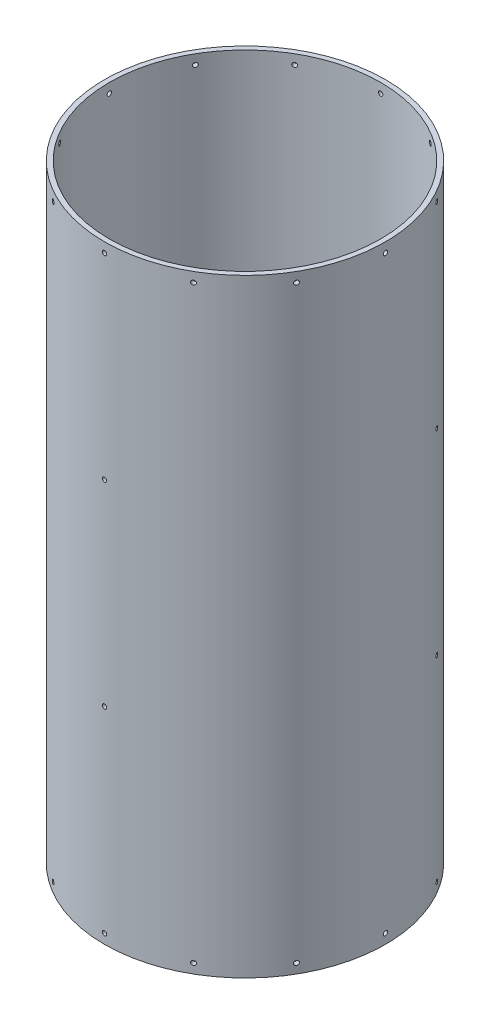
from build123d import *

# Parameters (mm, degrees)
SKETCH1_R                = 92.075
SKETCH1_R_2              = 88.9
BOSS_EXTRUDE1_DEPTH      = 199.39
SKETCH3_R                = 1.4351
CUT_EXTRUDE1_DEPTH       = 19.304
CIRPATTERN1_COUNT        = 12
MIRROR1_COPY_1_SKETCH_R  = 1.4351
MIRROR1_COPY_1_DEPTH     = 19.304
MIRROR1_COPY_2_SKETCH_R  = 1.4351
MIRROR1_COPY_2_DEPTH     = 19.304
MIRROR1_COPY_3_SKETCH_R  = 1.4351
MIRROR1_COPY_3_DEPTH     = 19.304
MIRROR1_COPY_4_SKETCH_R  = 1.4351
MIRROR1_COPY_4_DEPTH     = 19.304
MIRROR1_COPY_5_SKETCH_R  = 1.4351
MIRROR1_COPY_5_DEPTH     = 19.304
MIRROR1_COPY_6_SKETCH_R  = 1.4351
MIRROR1_COPY_6_DEPTH     = 19.304
MIRROR1_COPY_7_SKETCH_R  = 1.4351
MIRROR1_COPY_7_DEPTH     = 19.304
MIRROR1_COPY_8_SKETCH_R  = 1.4351
MIRROR1_COPY_8_DEPTH     = 19.304
MIRROR1_COPY_9_SKETCH_R  = 1.4351
MIRROR1_COPY_9_DEPTH     = 19.304
MIRROR1_COPY_10_SKETCH_R = 1.4351
MIRROR1_COPY_10_DEPTH    = 19.304
MIRROR1_COPY_11_SKETCH_R = 1.4351
MIRROR1_COPY_11_DEPTH    = 19.304
SKETCH4_R                = 1.4351
CUT_EXTRUDE2_DEPTH       = 43.18
CIRPATTERN2_COUNT        = 3


with BuildPart() as part:
    # Sketch1 → Boss-Extrude1 (new, symmetric)
    with BuildSketch(Plane(origin=(0, 0, 0), x_dir=(1, 0, 0), z_dir=(0, 1, 0))):
        Circle(SKETCH1_R)
        Circle(SKETCH1_R_2, mode=Mode.SUBTRACT)
    extrude(amount=BOSS_EXTRUDE1_DEPTH, both=True)

    # Sketch3 → Cut-Extrude1 (cut)
    with BuildSketch(Plane.XY.offset(92.075)):
        with Locations((0, -193.04)):
            Circle(SKETCH3_R)
    cut_extrude1 = extrude(amount=-CUT_EXTRUDE1_DEPTH, mode=Mode.SUBTRACT)

    # CirPattern1: Cut-Extrude1 ×12 about axis
    cirpattern1_axis = Axis((0, 199.39, 0), (0, -1, 0))
    for i in range(1, CIRPATTERN1_COUNT):
        add(cut_extrude1.rotate(cirpattern1_axis, i * 360 / CIRPATTERN1_COUNT), mode=Mode.SUBTRACT)

    # Mirror1: Cut-Extrude1 across plane
    add(cut_extrude1.mirror(Plane.ZX), mode=Mode.SUBTRACT)

    # Mirror1 copy 1 sketch → Mirror1 copy 1 (cut)
    with BuildSketch(Plane(origin=(-46.0375, 0, 79.739289053), x_dir=(0.8660254037844387, 0, 0.49999999999999994), z_dir=(-0.49999999999999994, 0, 0.8660254037844387))):
        with Locations((0, 193.04)):
            Circle(MIRROR1_COPY_1_SKETCH_R)
    extrude(amount=-MIRROR1_COPY_1_DEPTH, mode=Mode.SUBTRACT)

    # Mirror1 copy 2 sketch → Mirror1 copy 2 (cut)
    with BuildSketch(Plane(origin=(-79.739289053, 0, 46.0375), x_dir=(0.5000000000000001, 0, 0.8660254037844386), z_dir=(-0.8660254037844386, 0, 0.5000000000000001))):
        with Locations((0, 193.04)):
            Circle(MIRROR1_COPY_2_SKETCH_R)
    extrude(amount=-MIRROR1_COPY_2_DEPTH, mode=Mode.SUBTRACT)

    # Mirror1 copy 3 sketch → Mirror1 copy 3 (cut)
    with BuildSketch(Plane.ZY.offset(92.075)):
        with Locations((0, 193.04)):
            Circle(MIRROR1_COPY_3_SKETCH_R)
    extrude(amount=-MIRROR1_COPY_3_DEPTH, mode=Mode.SUBTRACT)

    # Mirror1 copy 4 sketch → Mirror1 copy 4 (cut)
    with BuildSketch(Plane(origin=(-79.739289053, 0, -46.0375), x_dir=(-0.4999999999999998, 0, 0.8660254037844387), z_dir=(-0.8660254037844387, 0, -0.4999999999999998))):
        with Locations((0, 193.04)):
            Circle(MIRROR1_COPY_4_SKETCH_R)
    extrude(amount=-MIRROR1_COPY_4_DEPTH, mode=Mode.SUBTRACT)

    # Mirror1 copy 5 sketch → Mirror1 copy 5 (cut)
    with BuildSketch(Plane(origin=(-46.0375, 0, -79.739289053), x_dir=(-0.8660254037844387, 0, 0.49999999999999994), z_dir=(-0.49999999999999994, 0, -0.8660254037844387))):
        with Locations((0, 193.04)):
            Circle(MIRROR1_COPY_5_SKETCH_R)
    extrude(amount=-MIRROR1_COPY_5_DEPTH, mode=Mode.SUBTRACT)

    # Mirror1 copy 6 sketch → Mirror1 copy 6 (cut)
    with BuildSketch(Plane(origin=(0, 0, -92.075), x_dir=(-1, 0, 0), z_dir=(0, 0, -1))):
        with Locations((0, 193.04)):
            Circle(MIRROR1_COPY_6_SKETCH_R)
    extrude(amount=-MIRROR1_COPY_6_DEPTH, mode=Mode.SUBTRACT)

    # Mirror1 copy 7 sketch → Mirror1 copy 7 (cut)
    with BuildSketch(Plane(origin=(46.0375, 0, -79.739289053), x_dir=(-0.8660254037844386, 0, -0.5000000000000001), z_dir=(0.5000000000000001, 0, -0.8660254037844386))):
        with Locations((0, 193.04)):
            Circle(MIRROR1_COPY_7_SKETCH_R)
    extrude(amount=-MIRROR1_COPY_7_DEPTH, mode=Mode.SUBTRACT)

    # Mirror1 copy 8 sketch → Mirror1 copy 8 (cut)
    with BuildSketch(Plane(origin=(79.739289053, 0, -46.0375), x_dir=(-0.5000000000000004, 0, -0.8660254037844384), z_dir=(0.8660254037844384, 0, -0.5000000000000004))):
        with Locations((0, 193.04)):
            Circle(MIRROR1_COPY_8_SKETCH_R)
    extrude(amount=-MIRROR1_COPY_8_DEPTH, mode=Mode.SUBTRACT)

    # Mirror1 copy 9 sketch → Mirror1 copy 9 (cut)
    with BuildSketch(Plane(origin=(92.075, 0, 0), x_dir=(0, 0, -1), z_dir=(1, 0, 0))):
        with Locations((0, 193.04)):
            Circle(MIRROR1_COPY_9_SKETCH_R)
    extrude(amount=-MIRROR1_COPY_9_DEPTH, mode=Mode.SUBTRACT)

    # Mirror1 copy 10 sketch → Mirror1 copy 10 (cut)
    with BuildSketch(Plane(origin=(79.739289053, 0, 46.0375), x_dir=(0.5000000000000001, 0, -0.8660254037844386), z_dir=(0.8660254037844386, 0, 0.5000000000000001))):
        with Locations((0, 193.04)):
            Circle(MIRROR1_COPY_10_SKETCH_R)
    extrude(amount=-MIRROR1_COPY_10_DEPTH, mode=Mode.SUBTRACT)

    # Mirror1 copy 11 sketch → Mirror1 copy 11 (cut)
    with BuildSketch(Plane(origin=(46.0375, 0, 79.739289053), x_dir=(0.8660254037844384, 0, -0.5000000000000004), z_dir=(0.5000000000000004, 0, 0.8660254037844384))):
        with Locations((0, 193.04)):
            Circle(MIRROR1_COPY_11_SKETCH_R)
    extrude(amount=-MIRROR1_COPY_11_DEPTH, mode=Mode.SUBTRACT)

    # Sketch4 → Cut-Extrude2 (cut)
    with BuildSketch(Plane.XY.offset(92.075)):
        with Locations((0, 64.3636)):
            Circle(SKETCH4_R)
        with Locations((0, -64.3636)):
            Circle(SKETCH4_R)
    cut_extrude2 = extrude(amount=-CUT_EXTRUDE2_DEPTH, mode=Mode.SUBTRACT)

    # CirPattern2: Cut-Extrude2 ×3 about axis
    cirpattern2_axis = Axis((0, 199.39, 0), (0, -1, 0))
    for i in range(1, CIRPATTERN2_COUNT):
        add(cut_extrude2.rotate(cirpattern2_axis, i * 360 / CIRPATTERN2_COUNT), mode=Mode.SUBTRACT)


solid = part.part
